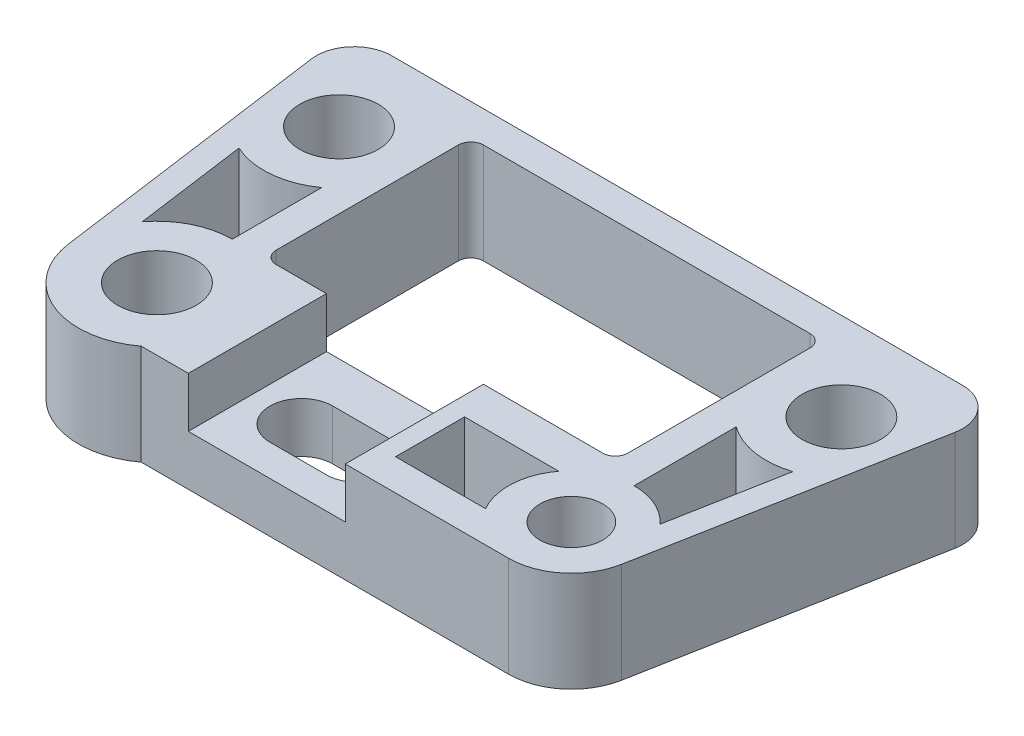
from build123d import *

# Parameters (mm, degrees)
SKETCH3_R           = 3.96875
SKETCH3_R_2         = 3.175
BOSS_EXTRUDE4_DEPTH = 10.16
SKETCH5_W           = 15.875
SKETCH5_H           = 13.97
CUT_EXTRUDE3_DEPTH  = 5.08
FILLET1_R           = 3.81


with BuildPart() as part:
    # Sketch3 → Boss-Extrude4 (new body)
    with BuildSketch(Plane(origin=(0, 0, 0), x_dir=(1, 0, 0), z_dir=(0, 1, 0))):
        with BuildLine():
            Line((54.2925, 31.75), (-12.3825, 31.75))
            Line((-12.3825, 31.75), (-7.863361559, -1.082336008))
            ThreePointArc((-7.863361559, -1.082336008), (-3.056289676, -7.325503373), (4.7625, -6.35))
            Line((4.7625, -6.35), (41.91, -6.35))
            ThreePointArc((41.91, -6.35), (45.967580476, -4.884520517), (48.152310263, -1.164501002))
            Line((48.152310263, -1.164501002), (54.2925, 31.75))
        make_face()
        Circle(SKETCH3_R, mode=Mode.SUBTRACT)
        with Locations((-4.445, 22.86)):
            Circle(SKETCH3_R, mode=Mode.SUBTRACT)
        with Locations((46.355, 22.86)):
            Circle(SKETCH3_R, mode=Mode.SUBTRACT)
        with Locations((41.91, 0)):
            Circle(SKETCH3_R_2, mode=Mode.SUBTRACT)
        with BuildLine():
            Line((38.735, 8.89), (38.735, 27.305))
            ThreePointArc((38.735, 27.305), (38.363025612, 28.203025612), (37.465, 28.575))
            Line((37.465, 28.575), (4.445, 28.575))
            ThreePointArc((4.445, 28.575), (3.546974388, 28.203025612), (3.175, 27.305))
            Line((3.175, 27.305), (3.175, 8.89))
            ThreePointArc((3.175, 8.89), (3.546974388, 7.991974388), (4.445, 7.62))
            Line((4.445, 7.62), (37.465, 7.62))
            ThreePointArc((37.465, 7.62), (38.363025612, 7.991974388), (38.735, 8.89))
        make_face(mode=Mode.SUBTRACT)
        with BuildLine():
            Line((20.32, 3.175), (14.605, 3.175))
            ThreePointArc((14.605, 3.175), (11.43, 0), (14.605, -3.175))
            Line((14.605, -3.175), (20.32, -3.175))
            ThreePointArc((20.32, -3.175), (22.498043553, -2.310140965), (23.489504023, -0.186733089))
            Line((23.489504023, -0.186733089), (21.228562514, 3.04222602))
            ThreePointArc((21.228562514, 3.04222602), (20.779106407, 3.141631154), (20.32, 3.175))
        make_face(mode=Mode.SUBTRACT)
        with BuildLine():
            Line((46.58698696, 4.295147609), (48.697586564, 15.60902157))
            ThreePointArc((48.697586564, 15.60902157), (45.177345011, 15.331552037), (41.91, 16.670785591))
            Line((41.91, 16.670785591), (41.91, 6.35))
            ThreePointArc((41.91, 6.35), (44.464242812, 5.81363429), (46.58698696, 4.295147609))
        make_face(mode=Mode.SUBTRACT)
        with BuildLine():
            Line((-6.080523252, 4.592563226), (-7.642900683, 15.943510195))
            ThreePointArc((-7.642900683, 15.943510195), (-3.723164456, 15.274266453), (0, 16.670785591))
            Line((0, 16.670785591), (0, 7.62))
            ThreePointArc((0, 7.62), (-3.396252951, 6.82128037), (-6.080523252, 4.592563226))
        make_face(mode=Mode.SUBTRACT)
        with BuildLine():
            Line((36.410738686, -3.175), (27.305, -3.175))
            Line((27.305, -3.175), (27.305, 3.81))
            Line((27.305, 3.81), (36.83, 3.81))
            ThreePointArc((36.83, 3.81), (35.571407985, 0.380461907), (36.410738686, -3.175))
        make_face(mode=Mode.SUBTRACT)
    extrude(amount=BOSS_EXTRUDE4_DEPTH)

    # Sketch5 → Cut-Extrude3 (cut)
    with BuildSketch(Plane(origin=(0, 10.16, 0), x_dir=(1, 0, 0), z_dir=(0, 1, 0))):
        with Locations((17.4625, 0.635)):
            Rectangle(SKETCH5_W, SKETCH5_H)
    extrude(amount=-CUT_EXTRUDE3_DEPTH, mode=Mode.SUBTRACT)

    # Fillet1
    fillet1_edges = [part.edges().sort_by_distance(p)[0] for p in [
        (-12.3825, 5.08, -31.75),
        (54.2925, 5.08, -31.75),
    ]]
    fillet(fillet1_edges, radius=FILLET1_R)


solid = part.part
